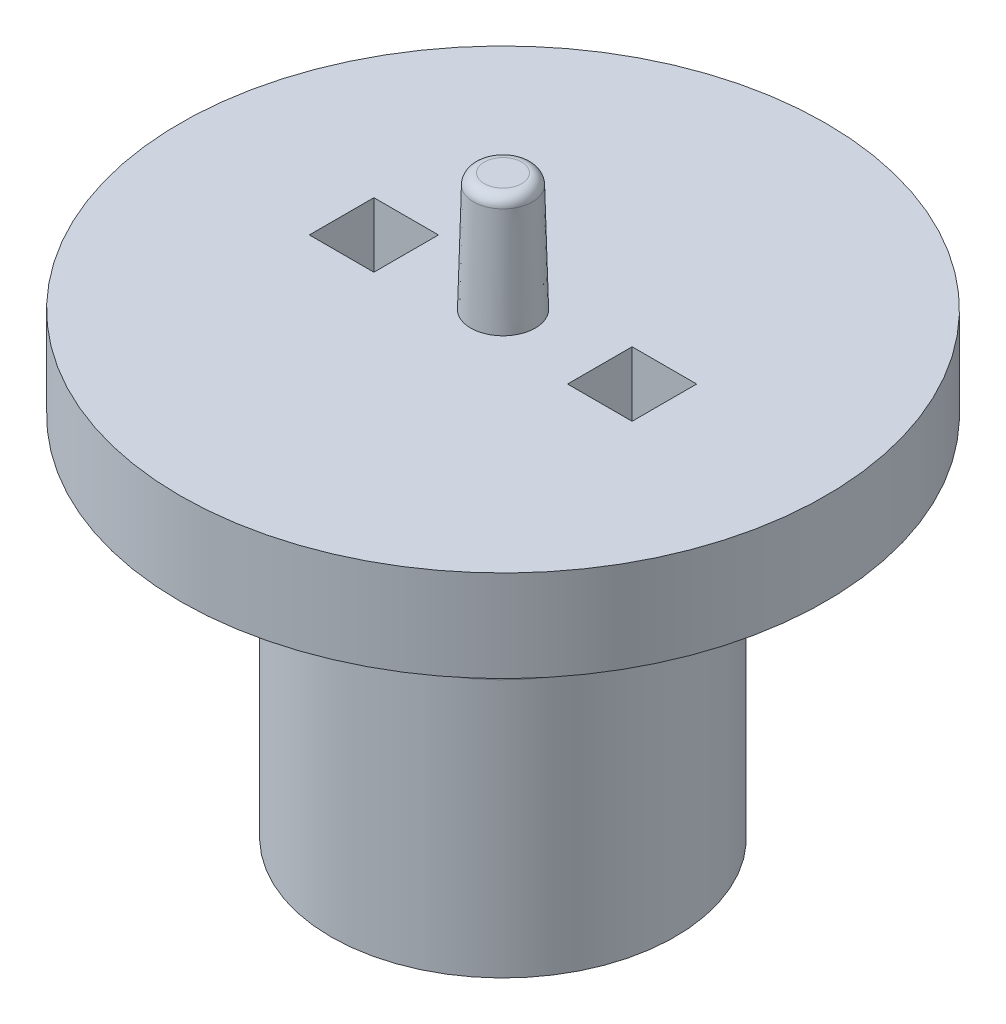
from build123d import *

# Parameters (mm, degrees)
SKETCH1_R           = 8
SKETCH1_R_2         = 2.575
BOSS_EXTRUDE1_DEPTH = 15
SKETCH2_R           = 1.25
CUT_EXTRUDE1_DEPTH  = 19.788294228
SKETCH12_R          = 8
BOSS_EXTRUDE3_DEPTH = 2
SKETCH11_R          = 15
SKETCH11_W          = 3
SKETCH11_H          = 3
BOSS_EXTRUDE2_DEPTH = 4.25
SKETCH13_R          = 1.5
BOSS_EXTRUDE4_DEPTH = 5.5
BOSS_EXTRUDE4_TAPER = 1.5
FILLET2_R           = 0.5
FILLET4_R           = 5
THREAD1_PITCH       = 0.5


with BuildPart() as part:
    # Sketch1 → Boss-Extrude1 (new body)
    with BuildSketch(Plane(origin=(0, 0, 0), x_dir=(1, 0, 0), z_dir=(0, 1, 0))):
        with Locations(Location((0, 0, 0), (0, 0, 270))):
            Circle(SKETCH1_R)
        with Locations(Location((0, 0, 0), (0, 0, 270))):
            Circle(SKETCH1_R_2, mode=Mode.SUBTRACT)
    extrude(amount=BOSS_EXTRUDE1_DEPTH)

    # Sketch2 → Cut-Extrude1 (cut, through all)
    with BuildSketch(Plane.XY):
        with Locations(Location((0, 7.5, 0), (0, 0, 90))):
            Circle(SKETCH2_R)
    extrude(amount=-CUT_EXTRUDE1_DEPTH, mode=Mode.SUBTRACT)

    # Sketch12 → Boss-Extrude3 (add)
    with BuildSketch(Plane(origin=(0, 15, 0), x_dir=(1, 0, 0), z_dir=(0, 1, 0))):
        with Locations(Location((0, 0, 0), (0, 0, 270))):
            Circle(SKETCH12_R)
    extrude(amount=BOSS_EXTRUDE3_DEPTH)

    # Sketch11 → Boss-Extrude2 (add)
    with BuildSketch(Plane(origin=(0, 17, 0), x_dir=(1, 0, 0), z_dir=(0, 1, 0))):
        with Locations(Location((0, 0, 0), (0, 0, 270))):
            Circle(SKETCH11_R)
        with Locations((-6, 0)):
            Rectangle(SKETCH11_W, SKETCH11_H, mode=Mode.SUBTRACT)
        with Locations((6, 0)):
            Rectangle(SKETCH11_W, SKETCH11_H, mode=Mode.SUBTRACT)
    extrude(amount=BOSS_EXTRUDE2_DEPTH)

    # Sketch13 → Boss-Extrude4 (add)
    with BuildSketch(Plane(origin=(0, 21.25, 0), x_dir=(1, 0, 0), z_dir=(0, 1, 0))):
        Circle(SKETCH13_R)
    extrude(amount=BOSS_EXTRUDE4_DEPTH, taper=BOSS_EXTRUDE4_TAPER)

    # Fillet2
    fillet2_edges = [part.edges().sort_by_distance(p)[0] for p in [
        (-1.355977431, 26.75, 0),
    ]]
    fillet(fillet2_edges, radius=FILLET2_R)

    # Fillet4
    fillet4_edges = [part.edges().sort_by_distance(p)[0] for p in [
        (0, 17, -8),
    ]]
    fillet(fillet4_edges, radius=FILLET4_R)

    # Thread1: the profile of Thread Profile1 profile screwed along a right-hand helix of 20 turns, 6 arcs to a turn; built about Z, then put on its axis
    thread1_z = Axis((0, 0, 0), (0, 0, 1))
    thread1_corners = [(1.2497, 0, -0.000173205), (1.520632938, 0, 0.156249999), (1.520632937, 0, 0.218749999), (1.2497, 0, 0.375173204)]
    with BuildLine(mode=Mode.PRIVATE) as thread1_profile:
        Line(thread1_corners[0], thread1_corners[1])
        Line(thread1_corners[1], thread1_corners[2])
        Line(thread1_corners[2], thread1_corners[3])
        Line(thread1_corners[3], thread1_corners[0])
    thread1_cap = Face(thread1_profile.wire())
    thread1_turn_angles = [0, 30, 60, 90, 120, 150, 180, 210, 240, 270, 300, 330, 360]
    thread1_turn_weights = [1, 0.8660254037844387, 1, 0.8660254037844387, 1, 0.8660254037844387, 1, 0.8660254037844387, 1, 0.8660254037844387, 1, 0.8660254037844387, 1]
    thread1_turn_rails = [Edge.make_bspline([Vector(p[0], p[1], 0).rotate(thread1_z, thread1_turn_angles[k]) / thread1_turn_weights[k] + Vector(0, 0, p[2] + THREAD1_PITCH * thread1_turn_angles[k] / 360) for k in range(13)], [0, 0, 0, 1, 1, 2, 2, 3, 3, 4, 4, 5, 5, 6, 6, 6], 2, thread1_turn_weights) for p in thread1_corners]
    thread1_turn_sides = [Face.make_surface_from_curves(thread1_turn_rails[p[0]], thread1_turn_rails[p[1]]) for p in [(0, 1), (1, 2), (2, 3), (3, 0)]]
    thread1 = Plane(origin=(0, 7.5, -9.5), x_dir=(1, 0, 0), z_dir=(0, 0, 1)) * Solid(Shell([*[p.moved(Location((0, 0, THREAD1_PITCH * i))) for i in range(20) for p in thread1_turn_sides], thread1_cap, thread1_cap.rotate(thread1_z, 7200).moved(Location((0, 0, THREAD1_PITCH * 7200 / 360)))]))
    add(thread1, mode=Mode.SUBTRACT)

    # Cut-Extrude2 cone 1 section (through the dimple's axis) → Cut-Extrude2 (revolve, cut)
    with BuildSketch(Plane(origin=(0, 7.5, -8), x_dir=(0, 1, 0), z_dir=(1.0, 0, -3e-09))):
        Polygon((0, 0), (1.75, 0), (0, 1.75), align=None)
    revolve(axis=Axis((0, 7.5, -8), (3e-09, 0, 1.0)), mode=Mode.SUBTRACT)


solid = part.part
